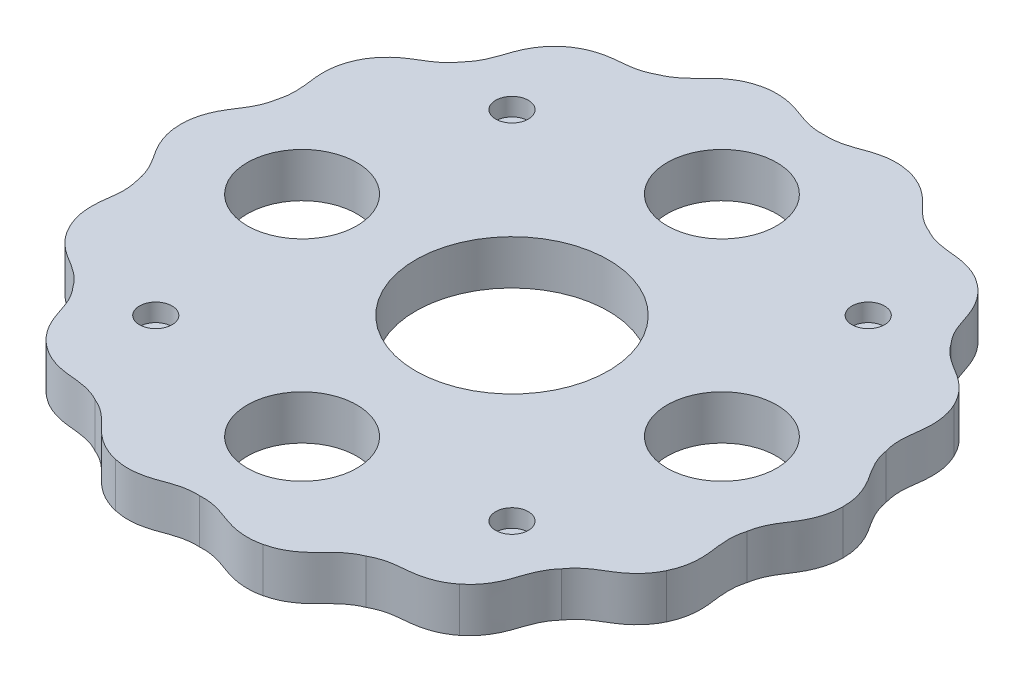
from build123d import *

# Parameters (mm, degrees)
BOSS_EXTRUDE3_DEPTH = 4.7625
SKETCH2_R           = 10.328125
SKETCH2_R_2         = 5.875
CUT_EXTRUDE1_DEPTH  = 4.7625
SKETCH2_4_R         = 1.75
CUT_EXTRUDE2_DEPTH  = 1.9125


with BuildPart() as part:
    # Sketch1 → Boss-Extrude3 (new body)
    with BuildSketch(Plane(origin=(0, 0, 0), x_dir=(1, 0, 0), z_dir=(0, 1, 0))):
        with BuildLine():
            Line((35.500002326, 0.003735881), (35.500002326, 0))
            Line((35.500002326, 0), (35.500002326, -0.003735881))
            add(Edge.make_bspline(
                [(32.644810899, -7.45096506), (32.674793712, -7.260710929), (32.757965618, -6.873262555), (32.975088878, -6.197475635), (33.30681421, -5.487322542), (33.693887271, -4.83935734), (34.139372051, -4.165162167), (34.499748971, -3.6014921), (34.870711868, -2.889611748), (35.149566879, -2.192738575), (35.418263863, -1.23361479), (35.50061524, -0.495919336), (35.500002326, -0.003735881)],
                knots=[0.02301065, 0.02301065, 0.02301065, 0.02301065, 0.053541567, 0.084072485, 0.145134319, 0.206196153, 0.267257988, 0.389381656, 0.511505325, 0.633628994, 0.755752663, 1, 1, 1, 1], degree=3))
            add(Edge.make_bspline(
                [(31.986017844, -15.399507835), (32.200120458, -14.956331799), (32.445998494, -14.255960238), (32.62005909, -13.275236314), (32.671181344, -12.526384626), (32.645828632, -11.724047822), (32.565707523, -11.059836954), (32.456861927, -10.25911949), (32.389262714, -9.507378309), (32.398512397, -8.723622254), (32.496104055, -8.020553026), (32.589276306, -7.635387164), (32.644810899, -7.45096506)],
                knots=[0.02301065, 0.02301065, 0.02301065, 0.02301065, 0.267257988, 0.389381656, 0.511505325, 0.633628994, 0.755752663, 0.816814497, 0.877876331, 0.938938166, 0.969469083, 1, 1, 1, 1], degree=3))
            Line((31.986017844, -15.399507835), (31.984396906, -15.402873748))
            Line((31.984396906, -15.402873748), (31.982775968, -15.406239661))
            add(Edge.make_bspline(
                [(26.179105738, -20.877140171), (26.288667493, -20.718736177), (26.531710341, -20.405744191), (27.020544594, -19.891087467), (27.62754267, -19.395191866), (28.257425012, -18.979340099), (28.951315253, -18.565199839), (29.520570914, -18.213712342), (30.163670245, -17.733285076), (30.717271866, -17.226414698), (31.375507699, -16.478857279), (31.769777787, -15.849947564), (31.982775968, -15.406239661)],
                knots=[0.02301065, 0.02301065, 0.02301065, 0.02301065, 0.053541567, 0.084072485, 0.145134319, 0.206196153, 0.267257988, 0.389381656, 0.511505325, 0.633628994, 0.755752663, 1, 1, 1, 1], degree=3))
            add(Edge.make_bspline(
                [(22.136810246, -27.752690162), (22.521996911, -27.446297993), (23.047405198, -26.921967502), (23.62974854, -26.113887841), (24.00072267, -25.461376898), (24.326001557, -24.727496287), (24.542005228, -24.094299727), (24.791357022, -23.325651886), (25.05662051, -22.619026286), (25.405013194, -21.916899767), (25.797990545, -21.325799714), (26.049053047, -21.019203188), (26.179105738, -20.877140171)],
                knots=[0.02301065, 0.02301065, 0.02301065, 0.02301065, 0.267257988, 0.389381656, 0.511505325, 0.633628994, 0.755752663, 0.816814497, 0.877876331, 0.938938166, 0.969469083, 1, 1, 1, 1], degree=3))
            Line((22.136810246, -27.752690162), (22.133889416, -27.755019446))
            Line((22.133889416, -27.755019446), (22.130968587, -27.75734873))
            add(Edge.make_bspline(
                [(14.52830762, -30.168341629), (14.695748267, -30.073161626), (15.05052444, -29.89661793), (15.714250068, -29.645025478), (16.476297475, -29.461605575), (17.224233175, -29.360231784), (18.029095404, -29.288171996), (18.694481743, -29.218483478), (19.482343797, -29.064663811), (20.201044438, -28.848188121), (21.118447439, -28.460259983), (21.746546212, -28.06469929), (22.130968587, -27.75734873)],
                knots=[0.02301065, 0.02301065, 0.02301065, 0.02301065, 0.053541567, 0.084072485, 0.145134319, 0.206196153, 0.267257988, 0.389381656, 0.511505325, 0.633628994, 0.755752663, 1, 1, 1, 1], degree=3))
            add(Edge.make_bspline(
                [(7.903135888, -34.609111839), (8.383115662, -34.500188263), (9.083990645, -34.255748926), (9.959276491, -33.780363616), (10.576626521, -33.353431213), (11.188111536, -32.833360849), (11.657457809, -32.356590942), (12.215619812, -31.772252855), (12.761207314, -31.250698702), (13.379739556, -30.769266488), (13.990268616, -30.407210225), (14.349495361, -30.239908237), (14.52830762, -30.168341629)],
                knots=[0.02301065, 0.02301065, 0.02301065, 0.02301065, 0.267257988, 0.389381656, 0.511505325, 0.633628994, 0.755752663, 0.816814497, 0.877876331, 0.938938166, 0.969469083, 1, 1, 1, 1], degree=3))
            Line((7.903135888, -34.609111839), (7.899493673, -34.60994315))
            Line((7.899493673, -34.60994315), (7.895851458, -34.610774462))
            add(Edge.make_bspline(
                [(0, -33.484333037), (0.192155866, -33.471228592), (0.588397592, -33.466099831), (1.295555593, -33.527402621), (2.061719496, -33.692786976), (2.779570716, -33.925969485), (3.535992098, -34.210262493), (4.165721189, -34.43617562), (4.942300224, -34.639429423), (5.683752409, -34.756224087), (6.678619663, -34.804759157), (7.416144457, -34.72089313), (7.895851458, -34.610774462)],
                knots=[0.02301065, 0.02301065, 0.02301065, 0.02301065, 0.053541567, 0.084072485, 0.145134319, 0.206196153, 0.267257988, 0.389381656, 0.511505325, 0.633628994, 0.755752663, 1, 1, 1, 1], degree=3))
            add(Edge.make_bspline(
                [(-7.895851458, -34.610774462), (-7.416144457, -34.72089313), (-6.678619663, -34.804759157), (-5.683752409, -34.756224087), (-4.942300224, -34.639429423), (-4.165721189, -34.43617562), (-3.535992098, -34.210262493), (-2.779570716, -33.925969485), (-2.061719496, -33.692786976), (-1.295555593, -33.527402621), (-0.588397592, -33.466099831), (-0.192155866, -33.471228592), (0, -33.484333037)],
                knots=[0.02301065, 0.02301065, 0.02301065, 0.02301065, 0.267257988, 0.389381656, 0.511505325, 0.633628994, 0.755752663, 0.816814497, 0.877876331, 0.938938166, 0.969469083, 1, 1, 1, 1], degree=3))
            Line((-7.895851458, -34.610774462), (-7.899493673, -34.60994315))
            Line((-7.899493673, -34.60994315), (-7.903135888, -34.609111839))
            add(Edge.make_bspline(
                [(-14.52830762, -30.168341629), (-14.349495361, -30.239908237), (-13.990268616, -30.407210225), (-13.379739556, -30.769266488), (-12.761207314, -31.250698702), (-12.215619812, -31.772252855), (-11.657457809, -32.356590942), (-11.188111536, -32.833360849), (-10.576626521, -33.353431213), (-9.959276491, -33.780363616), (-9.083990645, -34.255748926), (-8.383115662, -34.500188263), (-7.903135888, -34.609111839)],
                knots=[0.02301065, 0.02301065, 0.02301065, 0.02301065, 0.053541567, 0.084072485, 0.145134319, 0.206196153, 0.267257988, 0.389381656, 0.511505325, 0.633628994, 0.755752663, 1, 1, 1, 1], degree=3))
            add(Edge.make_bspline(
                [(-22.130968587, -27.75734873), (-21.746546212, -28.06469929), (-21.118447439, -28.460259983), (-20.201044438, -28.848188121), (-19.482343797, -29.064663811), (-18.694481743, -29.218483478), (-18.029095404, -29.288171996), (-17.224233175, -29.360231784), (-16.476297475, -29.461605575), (-15.714250068, -29.645025478), (-15.05052444, -29.89661793), (-14.695748267, -30.073161626), (-14.52830762, -30.168341629)],
                knots=[0.02301065, 0.02301065, 0.02301065, 0.02301065, 0.267257988, 0.389381656, 0.511505325, 0.633628994, 0.755752663, 0.816814497, 0.877876331, 0.938938166, 0.969469083, 1, 1, 1, 1], degree=3))
            Line((-22.130968587, -27.75734873), (-22.133889416, -27.755019446))
            Line((-22.133889416, -27.755019446), (-22.136810246, -27.752690162))
            add(Edge.make_bspline(
                [(-26.179105738, -20.877140171), (-26.049053047, -21.019203188), (-25.797990545, -21.325799714), (-25.405013194, -21.916899767), (-25.05662051, -22.619026286), (-24.791357022, -23.325651886), (-24.542005228, -24.094299727), (-24.326001557, -24.727496287), (-24.00072267, -25.461376898), (-23.62974854, -26.113887841), (-23.047405198, -26.921967502), (-22.521996911, -27.446297993), (-22.136810246, -27.752690162)],
                knots=[0.02301065, 0.02301065, 0.02301065, 0.02301065, 0.053541567, 0.084072485, 0.145134319, 0.206196153, 0.267257988, 0.389381656, 0.511505325, 0.633628994, 0.755752663, 1, 1, 1, 1], degree=3))
            add(Edge.make_bspline(
                [(-31.982775968, -15.406239661), (-31.769777787, -15.849947564), (-31.375507698, -16.478857279), (-30.717271866, -17.226414698), (-30.163670245, -17.733285076), (-29.520570914, -18.213712342), (-28.951315253, -18.565199839), (-28.257425012, -18.979340099), (-27.62754267, -19.395191866), (-27.020544594, -19.891087467), (-26.531710341, -20.405744191), (-26.288667493, -20.718736177), (-26.179105738, -20.877140171)],
                knots=[0.02301065, 0.02301065, 0.02301065, 0.02301065, 0.267257988, 0.389381656, 0.511505325, 0.633628994, 0.755752663, 0.816814497, 0.877876331, 0.938938166, 0.969469083, 1, 1, 1, 1], degree=3))
            Line((-31.982775968, -15.406239661), (-31.984396906, -15.402873748))
            Line((-31.984396906, -15.402873748), (-31.986017844, -15.399507835))
            add(Edge.make_bspline(
                [(-32.644810899, -7.45096506), (-32.589276306, -7.635387164), (-32.496104055, -8.020553026), (-32.398512397, -8.723622254), (-32.389262714, -9.507378309), (-32.456861927, -10.25911949), (-32.565707523, -11.059836954), (-32.645828632, -11.724047822), (-32.671181344, -12.526384626), (-32.62005909, -13.275236314), (-32.445998494, -14.255960238), (-32.200120458, -14.956331799), (-31.986017844, -15.399507835)],
                knots=[0.02301065, 0.02301065, 0.02301065, 0.02301065, 0.053541567, 0.084072485, 0.145134319, 0.206196153, 0.267257988, 0.389381656, 0.511505325, 0.633628994, 0.755752663, 1, 1, 1, 1], degree=3))
            add(Edge.make_bspline(
                [(-35.500002326, -0.003735881), (-35.50061524, -0.495919336), (-35.418263863, -1.23361479), (-35.149566879, -2.192738575), (-34.870711868, -2.889611748), (-34.499748971, -3.6014921), (-34.139372051, -4.165162167), (-33.693887271, -4.83935734), (-33.30681421, -5.487322542), (-32.975088878, -6.197475635), (-32.757965618, -6.873262555), (-32.674793712, -7.260710929), (-32.644810899, -7.45096506)],
                knots=[0.02301065, 0.02301065, 0.02301065, 0.02301065, 0.267257988, 0.389381656, 0.511505325, 0.633628994, 0.755752663, 0.816814497, 0.877876331, 0.938938166, 0.969469083, 1, 1, 1, 1], degree=3))
            Line((-35.500002326, -0.003735881), (-35.500002326, 0))
            Line((-35.500002326, 0), (-35.500002326, 0.003735881))
            add(Edge.make_bspline(
                [(-32.644810899, 7.45096506), (-32.674793712, 7.260710929), (-32.757965618, 6.873262555), (-32.975088878, 6.197475635), (-33.30681421, 5.487322542), (-33.693887271, 4.83935734), (-34.139372051, 4.165162167), (-34.499748971, 3.6014921), (-34.870711868, 2.889611748), (-35.149566879, 2.192738575), (-35.418263863, 1.23361479), (-35.50061524, 0.495919336), (-35.500002326, 0.003735881)],
                knots=[0.02301065, 0.02301065, 0.02301065, 0.02301065, 0.053541567, 0.084072485, 0.145134319, 0.206196153, 0.267257988, 0.389381656, 0.511505325, 0.633628994, 0.755752663, 1, 1, 1, 1], degree=3))
            add(Edge.make_bspline(
                [(-31.986017844, 15.399507835), (-32.200120458, 14.956331799), (-32.445998494, 14.255960238), (-32.62005909, 13.275236314), (-32.671181344, 12.526384626), (-32.645828632, 11.724047822), (-32.565707523, 11.059836954), (-32.456861927, 10.25911949), (-32.389262714, 9.507378309), (-32.398512397, 8.723622254), (-32.496104055, 8.020553026), (-32.589276306, 7.635387164), (-32.644810899, 7.45096506)],
                knots=[0.02301065, 0.02301065, 0.02301065, 0.02301065, 0.267257988, 0.389381656, 0.511505325, 0.633628994, 0.755752663, 0.816814497, 0.877876331, 0.938938166, 0.969469083, 1, 1, 1, 1], degree=3))
            Line((-31.986017844, 15.399507835), (-31.984396906, 15.402873748))
            Line((-31.984396906, 15.402873748), (-31.982775968, 15.406239661))
            add(Edge.make_bspline(
                [(-26.179105738, 20.877140171), (-26.288667493, 20.718736177), (-26.531710341, 20.405744191), (-27.020544594, 19.891087467), (-27.62754267, 19.395191866), (-28.257425012, 18.979340099), (-28.951315253, 18.565199839), (-29.520570914, 18.213712342), (-30.163670245, 17.733285076), (-30.717271866, 17.226414698), (-31.375507699, 16.478857278), (-31.769777787, 15.849947564), (-31.982775968, 15.406239661)],
                knots=[0.02301065, 0.02301065, 0.02301065, 0.02301065, 0.053541567, 0.084072485, 0.145134319, 0.206196153, 0.267257988, 0.389381656, 0.511505325, 0.633628994, 0.755752663, 1, 1, 1, 1], degree=3))
            add(Edge.make_bspline(
                [(-22.136810246, 27.752690162), (-22.521996911, 27.446297993), (-23.047405198, 26.921967502), (-23.62974854, 26.113887841), (-24.00072267, 25.461376898), (-24.326001557, 24.727496287), (-24.542005228, 24.094299727), (-24.791357022, 23.325651886), (-25.05662051, 22.619026286), (-25.405013194, 21.916899767), (-25.797990545, 21.325799714), (-26.049053047, 21.019203188), (-26.179105738, 20.877140171)],
                knots=[0.02301065, 0.02301065, 0.02301065, 0.02301065, 0.267257988, 0.389381656, 0.511505325, 0.633628994, 0.755752663, 0.816814497, 0.877876331, 0.938938166, 0.969469083, 1, 1, 1, 1], degree=3))
            Line((-22.136810246, 27.752690162), (-22.133889416, 27.755019446))
            Line((-22.133889416, 27.755019446), (-22.130968587, 27.75734873))
            add(Edge.make_bspline(
                [(-14.52830762, 30.168341629), (-14.695748267, 30.073161626), (-15.05052444, 29.89661793), (-15.714250068, 29.645025478), (-16.476297475, 29.461605575), (-17.224233175, 29.360231784), (-18.029095404, 29.288171996), (-18.694481743, 29.218483478), (-19.482343797, 29.064663811), (-20.201044438, 28.848188121), (-21.118447439, 28.460259983), (-21.746546212, 28.06469929), (-22.130968587, 27.75734873)],
                knots=[0.02301065, 0.02301065, 0.02301065, 0.02301065, 0.053541567, 0.084072485, 0.145134319, 0.206196153, 0.267257988, 0.389381656, 0.511505325, 0.633628994, 0.755752663, 1, 1, 1, 1], degree=3))
            add(Edge.make_bspline(
                [(-7.903135888, 34.609111839), (-8.383115662, 34.500188263), (-9.083990645, 34.255748926), (-9.959276491, 33.780363616), (-10.576626521, 33.353431213), (-11.188111536, 32.833360849), (-11.657457809, 32.356590942), (-12.215619812, 31.772252855), (-12.761207314, 31.250698702), (-13.379739556, 30.769266488), (-13.990268616, 30.407210225), (-14.349495361, 30.239908237), (-14.52830762, 30.168341629)],
                knots=[0.02301065, 0.02301065, 0.02301065, 0.02301065, 0.267257988, 0.389381656, 0.511505325, 0.633628994, 0.755752663, 0.816814497, 0.877876331, 0.938938166, 0.969469083, 1, 1, 1, 1], degree=3))
            Line((-7.903135888, 34.609111839), (-7.899493673, 34.60994315))
            Line((-7.899493673, 34.60994315), (-7.895851458, 34.610774462))
            add(Edge.make_bspline(
                [(0, 33.484333037), (-0.192155866, 33.471228592), (-0.588397592, 33.466099831), (-1.295555593, 33.527402621), (-2.061719496, 33.692786976), (-2.779570716, 33.925969485), (-3.535992098, 34.210262493), (-4.165721189, 34.43617562), (-4.942300224, 34.639429423), (-5.683752409, 34.756224087), (-6.678619663, 34.804759157), (-7.416144457, 34.72089313), (-7.895851458, 34.610774462)],
                knots=[0.02301065, 0.02301065, 0.02301065, 0.02301065, 0.053541567, 0.084072485, 0.145134319, 0.206196153, 0.267257988, 0.389381656, 0.511505325, 0.633628994, 0.755752663, 1, 1, 1, 1], degree=3))
            add(Edge.make_bspline(
                [(7.895851458, 34.610774462), (7.416144457, 34.72089313), (6.678619663, 34.804759157), (5.683752409, 34.756224087), (4.942300224, 34.639429423), (4.165721189, 34.43617562), (3.535992098, 34.210262493), (2.779570716, 33.925969485), (2.061719496, 33.692786976), (1.295555593, 33.527402621), (0.588397592, 33.466099831), (0.192155866, 33.471228592), (0, 33.484333037)],
                knots=[0.02301065, 0.02301065, 0.02301065, 0.02301065, 0.267257988, 0.389381656, 0.511505325, 0.633628994, 0.755752663, 0.816814497, 0.877876331, 0.938938166, 0.969469083, 1, 1, 1, 1], degree=3))
            Line((7.895851458, 34.610774462), (7.899493673, 34.60994315))
            Line((7.899493673, 34.60994315), (7.903135888, 34.609111839))
            add(Edge.make_bspline(
                [(14.52830762, 30.168341629), (14.349495361, 30.239908237), (13.990268616, 30.407210225), (13.379739556, 30.769266488), (12.761207314, 31.250698702), (12.215619812, 31.772252855), (11.657457809, 32.356590942), (11.188111536, 32.833360849), (10.576626521, 33.353431213), (9.959276491, 33.780363616), (9.083990645, 34.255748926), (8.383115662, 34.500188263), (7.903135888, 34.609111839)],
                knots=[0.02301065, 0.02301065, 0.02301065, 0.02301065, 0.053541567, 0.084072485, 0.145134319, 0.206196153, 0.267257988, 0.389381656, 0.511505325, 0.633628994, 0.755752663, 1, 1, 1, 1], degree=3))
            add(Edge.make_bspline(
                [(22.130968587, 27.75734873), (21.746546212, 28.06469929), (21.118447439, 28.460259983), (20.201044438, 28.848188121), (19.482343797, 29.064663811), (18.694481743, 29.218483478), (18.029095404, 29.288171996), (17.224233175, 29.360231784), (16.476297475, 29.461605575), (15.714250068, 29.645025478), (15.05052444, 29.89661793), (14.695748267, 30.073161626), (14.52830762, 30.168341629)],
                knots=[0.02301065, 0.02301065, 0.02301065, 0.02301065, 0.267257988, 0.389381656, 0.511505325, 0.633628994, 0.755752663, 0.816814497, 0.877876331, 0.938938166, 0.969469083, 1, 1, 1, 1], degree=3))
            Line((22.130968587, 27.75734873), (22.133889416, 27.755019446))
            Line((22.133889416, 27.755019446), (22.136810246, 27.752690162))
            add(Edge.make_bspline(
                [(26.179105738, 20.877140171), (26.049053047, 21.019203188), (25.797990545, 21.325799714), (25.405013194, 21.916899767), (25.05662051, 22.619026286), (24.791357022, 23.325651886), (24.542005228, 24.094299727), (24.326001557, 24.727496287), (24.00072267, 25.461376898), (23.62974854, 26.113887841), (23.047405198, 26.921967502), (22.521996911, 27.446297993), (22.136810246, 27.752690162)],
                knots=[0.02301065, 0.02301065, 0.02301065, 0.02301065, 0.053541567, 0.084072485, 0.145134319, 0.206196153, 0.267257988, 0.389381656, 0.511505325, 0.633628994, 0.755752663, 1, 1, 1, 1], degree=3))
            add(Edge.make_bspline(
                [(31.982775968, 15.406239661), (31.769777787, 15.849947564), (31.375507698, 16.478857279), (30.717271866, 17.226414698), (30.163670245, 17.733285076), (29.520570914, 18.213712342), (28.951315253, 18.565199839), (28.257425012, 18.979340099), (27.62754267, 19.395191866), (27.020544594, 19.891087467), (26.531710341, 20.405744191), (26.288667493, 20.718736177), (26.179105738, 20.877140171)],
                knots=[0.02301065, 0.02301065, 0.02301065, 0.02301065, 0.267257988, 0.389381656, 0.511505325, 0.633628994, 0.755752663, 0.816814497, 0.877876331, 0.938938166, 0.969469083, 1, 1, 1, 1], degree=3))
            Line((31.982775968, 15.406239661), (31.984396906, 15.402873748))
            Line((31.984396906, 15.402873748), (31.986017844, 15.399507835))
            add(Edge.make_bspline(
                [(32.644810899, 7.45096506), (32.589276306, 7.635387164), (32.496104055, 8.020553026), (32.398512397, 8.723622254), (32.389262714, 9.507378309), (32.456861927, 10.25911949), (32.565707523, 11.059836954), (32.645828632, 11.724047822), (32.671181344, 12.526384626), (32.62005909, 13.275236314), (32.445998494, 14.255960238), (32.200120458, 14.956331799), (31.986017844, 15.399507835)],
                knots=[0.02301065, 0.02301065, 0.02301065, 0.02301065, 0.053541567, 0.084072485, 0.145134319, 0.206196153, 0.267257988, 0.389381656, 0.511505325, 0.633628994, 0.755752663, 1, 1, 1, 1], degree=3))
            add(Edge.make_bspline(
                [(35.500002326, 0.003735881), (35.50061524, 0.495919336), (35.418263863, 1.23361479), (35.149566879, 2.192738575), (34.870711868, 2.889611748), (34.499748971, 3.6014921), (34.139372051, 4.165162167), (33.693887271, 4.83935734), (33.30681421, 5.487322542), (32.975088878, 6.197475635), (32.757965618, 6.873262555), (32.674793712, 7.260710929), (32.644810899, 7.45096506)],
                knots=[0.02301065, 0.02301065, 0.02301065, 0.02301065, 0.267257988, 0.389381656, 0.511505325, 0.633628994, 0.755752663, 0.816814497, 0.877876331, 0.938938166, 0.969469083, 1, 1, 1, 1], degree=3))
        make_face()
    extrude(amount=BOSS_EXTRUDE3_DEPTH)

    # Sketch2 → Cut-Extrude1 (cut)
    with BuildSketch(Plane(origin=(0, 4.7625, 0), x_dir=(1, 0, 0), z_dir=(0, 1, 0))):
        Circle(SKETCH2_R)
        with Locations((22.5, 0)):
            Circle(SKETCH2_R_2)
        with Locations((0, -22.5)):
            Circle(SKETCH2_R_2)
        with Locations((-22.5, 0)):
            Circle(SKETCH2_R_2)
        with Locations((0, 22.5)):
            Circle(SKETCH2_R_2)
    extrude(amount=-CUT_EXTRUDE1_DEPTH, mode=Mode.SUBTRACT)

    # Sketch2<4> → Cut-Extrude2 (cut)
    with BuildSketch(Plane(origin=(0, 4.7625, 0), x_dir=(1, 0, 0), z_dir=(0, 1, 0))):
        with Locations((19.091883092, 19.091883092)):
            Circle(SKETCH2_4_R)
        with Locations((19.091883092, -19.091883092)):
            Circle(SKETCH2_4_R)
        with Locations((-19.091883092, -19.091883092)):
            Circle(SKETCH2_4_R)
        with Locations((-19.091883092, 19.091883092)):
            Circle(SKETCH2_4_R)
    extrude(amount=-CUT_EXTRUDE2_DEPTH, mode=Mode.SUBTRACT)


solid = part.part
